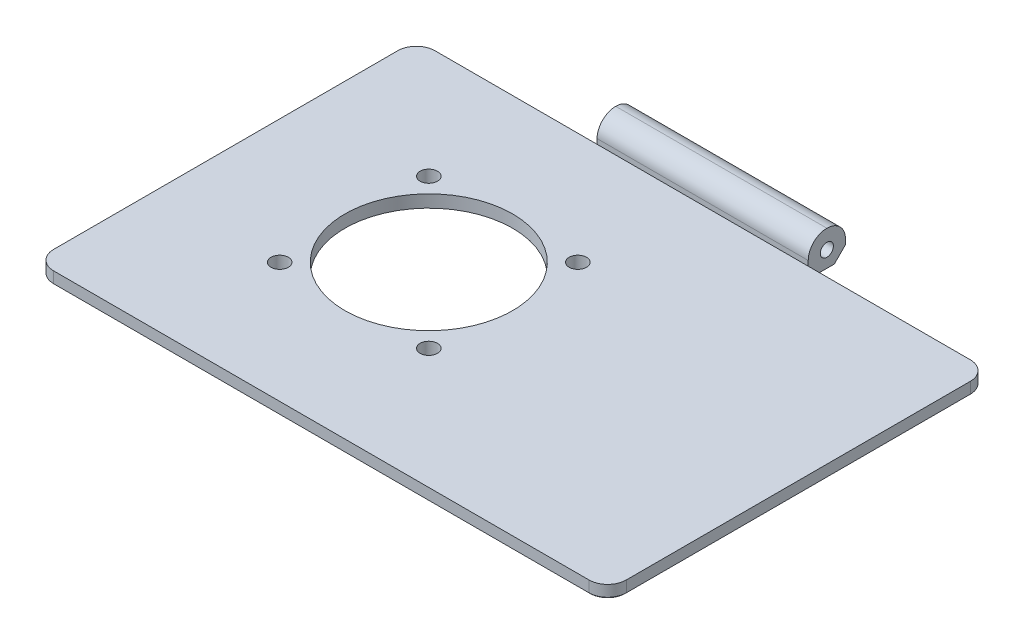
from build123d import *

# Parameters (mm, degrees)
EXTRUDE_1_DEPTH     = 2
SKETCH_2_W          = 34
SKETCH_2_H          = 6
EXTRUDE_2_DEPTH     = 5.8
SKETCH_3_R          = 1.05
CUT_EXTRUDE_1_DEPTH = 93.509513024
FILLET_1_R          = 3
CHAMFER_1_SIZE      = 2
SKETCH_4_R          = 1.4
SKETCH_4_R_2        = 13.5
CUT_EXTRUDE_2_DEPTH = 2
CHAMFER_2_SIZE      = 0.2


with BuildPart() as part:
    # 草图1 → 凸台-拉伸1 (new body)
    with BuildSketch(Plane(origin=(0, 0, 0), x_dir=(1, 0, 0), z_dir=(0, 1, 0))):
        with BuildLine():
            Line((3, 0), (89.2, 0))
            ThreePointArc((89.2, 0), (91.321320344, 0.878679656), (92.2, 3))
            Line((92.2, 3), (92.2, 58.4))
            ThreePointArc((92.2, 58.4), (91.321320344, 60.521320344), (89.2, 61.4))
            Line((89.2, 61.4), (3, 61.4))
            ThreePointArc((3, 61.4), (0.878679656, 60.521320344), (0, 58.4))
            Line((0, 58.4), (0, 3))
            ThreePointArc((0, 3), (0.878679656, 0.878679656), (3, 0))
        make_face()
    extrude(amount=EXTRUDE_1_DEPTH)

    # 草图2 → 凸台-拉伸2 (add)
    with BuildSketch(Plane(origin=(0, 0, 0), x_dir=(-1, 0, 0), z_dir=(0, -1, 0))):
        with Locations((-46.1, 64.4)):
            Rectangle(SKETCH_2_W, SKETCH_2_H)
    extrude(amount=-EXTRUDE_2_DEPTH)

    # 草图3 → 切除-拉伸1 (cut, through all)
    with BuildSketch(Plane(origin=(63.1, 0, 0), x_dir=(0, 0, -1), z_dir=(1, 0, 0))):
        with Locations((64.4, 2.8)):
            Circle(SKETCH_3_R)
    extrude(amount=-CUT_EXTRUDE_1_DEPTH, mode=Mode.SUBTRACT)

    # 圆角1
    fillet_1_edges = [part.edges().sort_by_distance(p)[0] for p in [
        (46.1, 5.8, -67.4),
        (46.1, 5.8, -61.4),
    ]]
    fillet(fillet_1_edges, radius=FILLET_1_R - 0.0001)  # a hair under: the kernel refuses the full size

    # 倒角1
    chamfer_1_edges = [part.edges().sort_by_distance(p)[0] for p in [
        (46.1, 0, -67.4),
    ]]
    chamfer(chamfer_1_edges, length=CHAMFER_1_SIZE)

    # 草图4 → 切除-拉伸2 (cut)
    with BuildSketch(Plane(origin=(0, 2, 0), x_dir=(1, 0, 0), z_dir=(0, 1, 0))):
        with Locations(Location((20, 43.4, 0), (0, 0, 270))):
            Circle(SKETCH_4_R)
        with Locations(Location((44, 43.4, 0), (0, 0, 270))):
            Circle(SKETCH_4_R)
        with Locations(Location((44, 19.4, 0), (0, 0, 270))):
            Circle(SKETCH_4_R)
        with Locations(Location((20, 19.4, 0), (0, 0, 270))):
            Circle(SKETCH_4_R)
        with Locations(Location((32, 31.4, 0), (0, 0, 270))):
            Circle(SKETCH_4_R_2)
    extrude(amount=-CUT_EXTRUDE_2_DEPTH, mode=Mode.SUBTRACT)

    # 倒角2
    chamfer_2_edges = [part.edges().sort_by_distance(p)[0] for p in [
        (0, 0, -30.7),
        (0.878679656, 0, -60.521320344),
        (76.15, 0, -61.4),
        (91.321320344, 0, -60.521320344),
        (16.05, 0, -61.4),
        (29.1, 0, -63.4),
        (63.1, 0, -63.4),
        (92.2, 0, -30.7),
        (91.321320344, 0, -0.878679656),
        (46.1, 0, 0),
        (0.878679656, 0, -0.878679656),
    ]]
    chamfer(chamfer_2_edges, length=CHAMFER_2_SIZE)


solid = part.part
